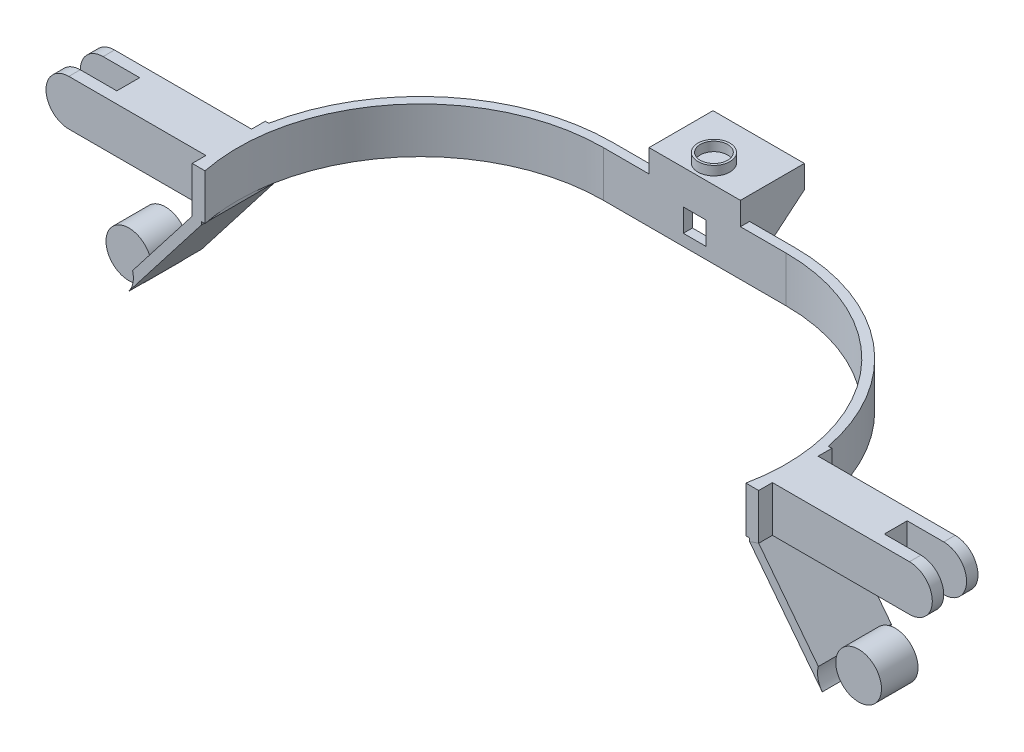
from build123d import *

# Parameters (mm, degrees)
EXTRUDE_1_DEPTH      = 20
SKETCH_18_W          = 10
SKETCH_18_H          = 10
CUT_EXTRUDE_6_DEPTH  = 10
SKETCH_20_W          = 40
SKETCH_20_H          = 4
EXTRUDE_5_DEPTH      = 10
SKETCH_8_W           = 4
SKETCH_8_H           = 32
SKETCH_25_W          = 246.903686524
SKETCH_25_H          = 75.06139437
CUT_EXTRUDE_7_DEPTH  = 30
SKETCH_11_W          = 4
SKETCH_11_H          = 32
SKETCH_26_W          = 20
SKETCH_26_H          = 20
EXTRUDE_6_DEPTH      = 70
SKETCH_28_W          = 20
SKETCH_28_H          = 20
EXTRUDE_7_DEPTH      = 70
SKETCH_29_W          = 26
SKETCH_29_H          = 10
CUT_EXTRUDE_8_DEPTH  = 20
SKETCH_31_R          = 10
CUT_EXTRUDE_10_DEPTH = 223.346636668
SKETCH_32_R          = 10
EXTRUDE_8_DEPTH      = 8
CUT_EXTRUDE_11_DEPTH = 221.494820316
EXTRUDE_9_DEPTH      = 24
CUT_EXTRUDE_12_DEPTH = 245.143330415
SKETCH_36_R          = 7
SKETCH_36_R_2        = 6
EXTRUDE_10_DEPTH     = 4


with BuildPart() as part:
    # 草图2 → 凸台-拉伸1 (new body)
    with BuildSketch(Plane(origin=(0, 0, 0), x_dir=(1, 0, 0), z_dir=(0, 1, 0))):
        with BuildLine():
            Line((-40, 84), (40, 84))
            ThreePointArc((40, 84), (124, 0), (40, -84))
            Line((40, -84), (-40, -84))
            ThreePointArc((-40, -84), (-124, 0), (-40, 84))
        make_face()
        with BuildLine():
            Line((-40, 80), (40, 80))
            ThreePointArc((40, 80), (120, 0), (40, -80))
            Line((40, -80), (-40, -80))
            ThreePointArc((-40, -80), (-120, 0), (-40, 80))
        make_face(mode=Mode.SUBTRACT)
    extrude(amount=EXTRUDE_1_DEPTH)

    # 草图18 → 切除-拉伸6 (cut)
    with BuildSketch(Plane(origin=(0, 0, -84), x_dir=(-1, 0, 0), z_dir=(0, 0, -1))):
        with Locations((0, 10)):
            Rectangle(SKETCH_18_W, SKETCH_18_H)
    extrude(amount=-CUT_EXTRUDE_6_DEPTH, mode=Mode.SUBTRACT)

    # 草图20 → 凸台-拉伸5 (add)
    with BuildSketch(Plane(origin=(0, 20, 0), x_dir=(1, 0, 0), z_dir=(0, 1, 0))):
        with Locations((0, 82)):
            Rectangle(SKETCH_20_W, SKETCH_20_H)
    extrude(amount=EXTRUDE_5_DEPTH)

    # 扫描1: sweep along a path in 草图9
    with BuildLine(Plane.XY) as sweep_1_path:
        Line((-124, 20), (-124, 0))
        Line((-124, 0), (-155, -40))
    # 草图8 → 扫描1 (sweep)
    with BuildSketch(Plane(origin=(0, 20, 0), x_dir=(1, 0, 0), z_dir=(0, 1, 0))):
        with Locations((-122, 0)):
            Rectangle(SKETCH_8_W, SKETCH_8_H)
    sweep(path=sweep_1_path.line, transition=Transition.RIGHT)

    # 草图25 → 切除-拉伸7 (cut)
    with BuildSketch(Plane(origin=(0, 20, 0), x_dir=(1, 0, 0), z_dir=(0, 1, 0))):
        with Locations((0.98973075, -53.530697185)):
            Rectangle(SKETCH_25_W, SKETCH_25_H)
    extrude(amount=-CUT_EXTRUDE_7_DEPTH, mode=Mode.SUBTRACT)

    # 扫描2: sweep along a path in 草图27
    with BuildLine(Plane.XY) as sweep_2_path:
        Line((124, 20), (124, 0))
        Line((124, 0), (155, -40))
    # 草图11 → 扫描2 (sweep)
    with BuildSketch(Plane(origin=(0, 20, 0), x_dir=(1, 0, 0), z_dir=(0, 1, 0))):
        with Locations((122, 0)):
            Rectangle(SKETCH_11_W, SKETCH_11_H)
    sweep(path=sweep_2_path.line, transition=Transition.RIGHT)

    # 草图26 → 凸台-拉伸6 (add)
    with BuildSketch(Plane.ZY.offset(124)):
        with Locations((0, 10)):
            Rectangle(SKETCH_26_W, SKETCH_26_H)
    extrude(amount=EXTRUDE_6_DEPTH)

    # 草图28 → 凸台-拉伸7 (add)
    with BuildSketch(Plane(origin=(124, 0, 0), x_dir=(0, 0, -1), z_dir=(1, 0, 0))):
        with Locations((0, 10)):
            Rectangle(SKETCH_28_W, SKETCH_28_H)
    extrude(amount=EXTRUDE_7_DEPTH)

    # 草图29 → 切除-拉伸8 (cut)
    with BuildSketch(Plane(origin=(0, 20, 0), x_dir=(1, 0, 0), z_dir=(0, 1, 0))):
        with Locations((-181, 0)):
            Rectangle(SKETCH_29_W, SKETCH_29_H)
        with Locations((181, 0)):
            Rectangle(SKETCH_29_W, SKETCH_29_H)
    extrude(amount=-CUT_EXTRUDE_8_DEPTH, mode=Mode.SUBTRACT)

    # 草图31 → 切除-拉伸10 (cut, through all)
    with BuildSketch(Plane.XY.offset(16)):
        with Locations((-159.742490313, -36.324570007)):
            Circle(SKETCH_31_R)
        with Locations((159.742490313, -36.324570007)):
            Circle(SKETCH_31_R)
    extrude(amount=-CUT_EXTRUDE_10_DEPTH, mode=Mode.SUBTRACT)

    # 草图32 → 凸台-拉伸8 (add, symmetric)
    with BuildSketch(Plane.XY):
        with Locations((-159.742490313, -36.324570007)):
            Circle(SKETCH_32_R)
        with Locations((159.742490313, -36.324570007)):
            Circle(SKETCH_32_R)
    extrude(amount=EXTRUDE_8_DEPTH, both=True)

    # 草图33 → 切除-拉伸11 (cut, through all)
    with BuildSketch(Plane.XY.offset(10)):
        with BuildLine():
            Line((-184, 20), (-199.388740024, 20))
            Line((-199.388740024, 20), (-199.388740024, 0))
            Line((-199.388740024, 0), (-184, 0))
            ThreePointArc((-184, 0), (-194, 10), (-184, 20))
        make_face()
        with BuildLine():
            Line((184, 20), (198.413524526, 20))
            Line((198.413524526, 20), (198.413524526, 0))
            Line((198.413524526, 0), (184, 0))
            ThreePointArc((184, 0), (194, 10), (184, 20))
        make_face()
    extrude(amount=-CUT_EXTRUDE_11_DEPTH, mode=Mode.SUBTRACT)

    # 草图34 → 凸台-拉伸9 (add)
    with BuildSketch(Plane(origin=(0, 0, -84), x_dir=(-1, 0, 0), z_dir=(0, 0, -1))):
        Polygon((20, 30), (-20, 30), (-20, 20), (-20, 0), (-12, 0), (-12, 20), (12, 20), (12, 0), (20, 0), (20, 20), align=None)
    extrude(amount=EXTRUDE_9_DEPTH)

    # 草图35 → 切除-拉伸12 (cut, through all)
    with BuildSketch(Plane(origin=(20, 0, 0), x_dir=(0, 0, -1), z_dir=(1, 0, 0))):
        Polygon((108, 20), (84, 0), (110.80524342, 0), align=None)
    extrude(amount=-CUT_EXTRUDE_12_DEPTH, mode=Mode.SUBTRACT)

    # 草图36 → 凸台-拉伸10 (add)
    with BuildSketch(Plane(origin=(0, 30, 0), x_dir=(1, 0, 0), z_dir=(0, 1, 0))):
        with Locations((0, 88.4)):
            Circle(SKETCH_36_R)
        with Locations((0, 88.4)):
            Circle(SKETCH_36_R_2, mode=Mode.SUBTRACT)
    extrude(amount=EXTRUDE_10_DEPTH)


solid = part.part
